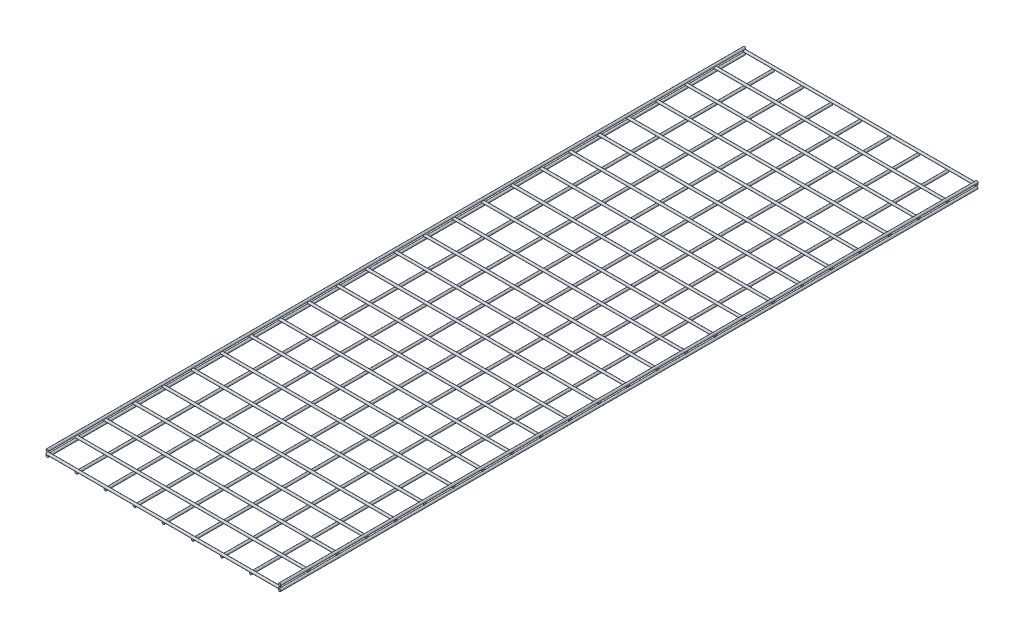
from build123d import *

# Parameters (mm, degrees)
SKETCH1_R              = 3.175
BOSS_EXTRUDE1_DEPTH    = 1828.8
BOSS_EXTRUDE1_2_DEPTH  = 1828.8
BOSS_EXTRUDE1_3_DEPTH  = 1828.8
BOSS_EXTRUDE1_4_DEPTH  = 1828.8
BOSS_EXTRUDE1_5_DEPTH  = 1828.8
BOSS_EXTRUDE1_6_DEPTH  = 1828.8
BOSS_EXTRUDE1_7_DEPTH  = 1828.8
BOSS_EXTRUDE1_8_DEPTH  = 1828.8
BOSS_EXTRUDE1_9_DEPTH  = 1828.8
BOSS_EXTRUDE1_10_DEPTH = 1828.8
BOSS_EXTRUDE1_11_DEPTH = 1828.8
SKETCH2_R              = 3.175
BOSS_EXTRUDE2_DEPTH    = 609.6
BOSS_EXTRUDE2_2_DEPTH  = 609.6
BOSS_EXTRUDE2_3_DEPTH  = 609.6
BOSS_EXTRUDE2_4_DEPTH  = 609.6
BOSS_EXTRUDE2_5_DEPTH  = 609.6
BOSS_EXTRUDE2_6_DEPTH  = 609.6
BOSS_EXTRUDE2_7_DEPTH  = 609.6
BOSS_EXTRUDE2_8_DEPTH  = 609.6
BOSS_EXTRUDE2_9_DEPTH  = 609.6
BOSS_EXTRUDE2_10_DEPTH = 609.6
BOSS_EXTRUDE2_11_DEPTH = 609.6
BOSS_EXTRUDE2_12_DEPTH = 609.6
BOSS_EXTRUDE2_13_DEPTH = 609.6
BOSS_EXTRUDE2_14_DEPTH = 609.6
BOSS_EXTRUDE2_15_DEPTH = 609.6
BOSS_EXTRUDE2_16_DEPTH = 609.6
BOSS_EXTRUDE2_17_DEPTH = 609.6
BOSS_EXTRUDE2_18_DEPTH = 609.6
BOSS_EXTRUDE2_19_DEPTH = 609.6
BOSS_EXTRUDE2_20_DEPTH = 609.6
BOSS_EXTRUDE2_21_DEPTH = 609.6
BOSS_EXTRUDE2_22_DEPTH = 609.6
BOSS_EXTRUDE2_23_DEPTH = 609.6
BOSS_EXTRUDE2_24_DEPTH = 609.6
BOSS_EXTRUDE2_25_DEPTH = 609.6


with BuildPart() as part:
    # Sketch1 → Boss-Extrude1 (new body)
    with BuildSketch(Plane.XY):
        Circle(SKETCH1_R)
    extrude(amount=BOSS_EXTRUDE1_DEPTH)


with BuildPart() as body_2:
    # Sketch1 → Boss-Extrude1 2 (new body)
    with BuildSketch(Plane.XY):
        with Locations((0, 12.7)):
            Circle(SKETCH1_R)
    extrude(amount=BOSS_EXTRUDE1_2_DEPTH)


with BuildPart() as body_3:
    # Sketch1 → Boss-Extrude1 3 (new body)
    with BuildSketch(Plane.XY):
        with Locations((76.2, 0)):
            Circle(SKETCH1_R)
    extrude(amount=BOSS_EXTRUDE1_3_DEPTH)


with BuildPart() as body_4:
    # Sketch1 → Boss-Extrude1 4 (new body)
    with BuildSketch(Plane.XY):
        with Locations((152.4, 0)):
            Circle(SKETCH1_R)
    extrude(amount=BOSS_EXTRUDE1_4_DEPTH)


with BuildPart() as body_5:
    # Sketch1 → Boss-Extrude1 5 (new body)
    with BuildSketch(Plane.XY):
        with Locations((228.6, 0)):
            Circle(SKETCH1_R)
    extrude(amount=BOSS_EXTRUDE1_5_DEPTH)


with BuildPart() as body_6:
    # Sketch1 → Boss-Extrude1 6 (new body)
    with BuildSketch(Plane.XY):
        with Locations((304.8, 0)):
            Circle(SKETCH1_R)
    extrude(amount=BOSS_EXTRUDE1_6_DEPTH)


with BuildPart() as body_7:
    # Sketch1 → Boss-Extrude1 7 (new body)
    with BuildSketch(Plane.XY):
        with Locations((381, 0)):
            Circle(SKETCH1_R)
    extrude(amount=BOSS_EXTRUDE1_7_DEPTH)


with BuildPart() as body_8:
    # Sketch1 → Boss-Extrude1 8 (new body)
    with BuildSketch(Plane.XY):
        with Locations((457.2, 0)):
            Circle(SKETCH1_R)
    extrude(amount=BOSS_EXTRUDE1_8_DEPTH)


with BuildPart() as body_9:
    # Sketch1 → Boss-Extrude1 9 (new body)
    with BuildSketch(Plane.XY):
        with Locations((533.4, 0)):
            Circle(SKETCH1_R)
    extrude(amount=BOSS_EXTRUDE1_9_DEPTH)


with BuildPart() as body_10:
    # Sketch1 → Boss-Extrude1 10 (new body)
    with BuildSketch(Plane.XY):
        with Locations((609.6, 0)):
            Circle(SKETCH1_R)
    extrude(amount=BOSS_EXTRUDE1_10_DEPTH)


with BuildPart() as body_11:
    # Sketch1 → Boss-Extrude1 11 (new body)
    with BuildSketch(Plane.XY):
        with Locations((609.6, 12.7)):
            Circle(SKETCH1_R)
    extrude(amount=BOSS_EXTRUDE1_11_DEPTH)


with BuildPart() as body_12:
    # Sketch2 → Boss-Extrude2 (new body)
    with BuildSketch(Plane(origin=(0, 0, 0), x_dir=(0, 0, -1), z_dir=(1, 0, 0))):
        with Locations((0, 6.35)):
            Circle(SKETCH2_R)
    extrude(amount=BOSS_EXTRUDE2_DEPTH)


with BuildPart() as body_13:
    # Sketch2 → Boss-Extrude2 2 (new body)
    with BuildSketch(Plane(origin=(0, 0, 0), x_dir=(0, 0, -1), z_dir=(1, 0, 0))):
        with Locations((-76.2, 6.35)):
            Circle(SKETCH2_R)
    extrude(amount=BOSS_EXTRUDE2_2_DEPTH)


with BuildPart() as body_14:
    # Sketch2 → Boss-Extrude2 3 (new body)
    with BuildSketch(Plane(origin=(0, 0, 0), x_dir=(0, 0, -1), z_dir=(1, 0, 0))):
        with Locations((-152.4, 6.35)):
            Circle(SKETCH2_R)
    extrude(amount=BOSS_EXTRUDE2_3_DEPTH)


with BuildPart() as body_15:
    # Sketch2 → Boss-Extrude2 4 (new body)
    with BuildSketch(Plane(origin=(0, 0, 0), x_dir=(0, 0, -1), z_dir=(1, 0, 0))):
        with Locations((-228.6, 6.35)):
            Circle(SKETCH2_R)
    extrude(amount=BOSS_EXTRUDE2_4_DEPTH)


with BuildPart() as body_16:
    # Sketch2 → Boss-Extrude2 5 (new body)
    with BuildSketch(Plane(origin=(0, 0, 0), x_dir=(0, 0, -1), z_dir=(1, 0, 0))):
        with Locations((-304.8, 6.35)):
            Circle(SKETCH2_R)
    extrude(amount=BOSS_EXTRUDE2_5_DEPTH)


with BuildPart() as body_17:
    # Sketch2 → Boss-Extrude2 6 (new body)
    with BuildSketch(Plane(origin=(0, 0, 0), x_dir=(0, 0, -1), z_dir=(1, 0, 0))):
        with Locations((-381, 6.35)):
            Circle(SKETCH2_R)
    extrude(amount=BOSS_EXTRUDE2_6_DEPTH)


with BuildPart() as body_18:
    # Sketch2 → Boss-Extrude2 7 (new body)
    with BuildSketch(Plane(origin=(0, 0, 0), x_dir=(0, 0, -1), z_dir=(1, 0, 0))):
        with Locations((-457.2, 6.35)):
            Circle(SKETCH2_R)
    extrude(amount=BOSS_EXTRUDE2_7_DEPTH)


with BuildPart() as body_19:
    # Sketch2 → Boss-Extrude2 8 (new body)
    with BuildSketch(Plane(origin=(0, 0, 0), x_dir=(0, 0, -1), z_dir=(1, 0, 0))):
        with Locations((-533.4, 6.35)):
            Circle(SKETCH2_R)
    extrude(amount=BOSS_EXTRUDE2_8_DEPTH)


with BuildPart() as body_20:
    # Sketch2 → Boss-Extrude2 9 (new body)
    with BuildSketch(Plane(origin=(0, 0, 0), x_dir=(0, 0, -1), z_dir=(1, 0, 0))):
        with Locations((-609.6, 6.35)):
            Circle(SKETCH2_R)
    extrude(amount=BOSS_EXTRUDE2_9_DEPTH)


with BuildPart() as body_21:
    # Sketch2 → Boss-Extrude2 10 (new body)
    with BuildSketch(Plane(origin=(0, 0, 0), x_dir=(0, 0, -1), z_dir=(1, 0, 0))):
        with Locations((-685.8, 6.35)):
            Circle(SKETCH2_R)
    extrude(amount=BOSS_EXTRUDE2_10_DEPTH)


with BuildPart() as body_22:
    # Sketch2 → Boss-Extrude2 11 (new body)
    with BuildSketch(Plane(origin=(0, 0, 0), x_dir=(0, 0, -1), z_dir=(1, 0, 0))):
        with Locations((-762, 6.35)):
            Circle(SKETCH2_R)
    extrude(amount=BOSS_EXTRUDE2_11_DEPTH)


with BuildPart() as body_23:
    # Sketch2 → Boss-Extrude2 12 (new body)
    with BuildSketch(Plane(origin=(0, 0, 0), x_dir=(0, 0, -1), z_dir=(1, 0, 0))):
        with Locations((-838.2, 6.35)):
            Circle(SKETCH2_R)
    extrude(amount=BOSS_EXTRUDE2_12_DEPTH)


with BuildPart() as body_24:
    # Sketch2 → Boss-Extrude2 13 (new body)
    with BuildSketch(Plane(origin=(0, 0, 0), x_dir=(0, 0, -1), z_dir=(1, 0, 0))):
        with Locations((-914.4, 6.35)):
            Circle(SKETCH2_R)
    extrude(amount=BOSS_EXTRUDE2_13_DEPTH)


with BuildPart() as body_25:
    # Sketch2 → Boss-Extrude2 14 (new body)
    with BuildSketch(Plane(origin=(0, 0, 0), x_dir=(0, 0, -1), z_dir=(1, 0, 0))):
        with Locations((-990.6, 6.35)):
            Circle(SKETCH2_R)
    extrude(amount=BOSS_EXTRUDE2_14_DEPTH)


with BuildPart() as body_26:
    # Sketch2 → Boss-Extrude2 15 (new body)
    with BuildSketch(Plane(origin=(0, 0, 0), x_dir=(0, 0, -1), z_dir=(1, 0, 0))):
        with Locations((-1066.8, 6.35)):
            Circle(SKETCH2_R)
    extrude(amount=BOSS_EXTRUDE2_15_DEPTH)


with BuildPart() as body_27:
    # Sketch2 → Boss-Extrude2 16 (new body)
    with BuildSketch(Plane(origin=(0, 0, 0), x_dir=(0, 0, -1), z_dir=(1, 0, 0))):
        with Locations((-1143, 6.35)):
            Circle(SKETCH2_R)
    extrude(amount=BOSS_EXTRUDE2_16_DEPTH)


with BuildPart() as body_28:
    # Sketch2 → Boss-Extrude2 17 (new body)
    with BuildSketch(Plane(origin=(0, 0, 0), x_dir=(0, 0, -1), z_dir=(1, 0, 0))):
        with Locations((-1219.2, 6.35)):
            Circle(SKETCH2_R)
    extrude(amount=BOSS_EXTRUDE2_17_DEPTH)


with BuildPart() as body_29:
    # Sketch2 → Boss-Extrude2 18 (new body)
    with BuildSketch(Plane(origin=(0, 0, 0), x_dir=(0, 0, -1), z_dir=(1, 0, 0))):
        with Locations((-1295.4, 6.35)):
            Circle(SKETCH2_R)
    extrude(amount=BOSS_EXTRUDE2_18_DEPTH)


with BuildPart() as body_30:
    # Sketch2 → Boss-Extrude2 19 (new body)
    with BuildSketch(Plane(origin=(0, 0, 0), x_dir=(0, 0, -1), z_dir=(1, 0, 0))):
        with Locations((-1371.6, 6.35)):
            Circle(SKETCH2_R)
    extrude(amount=BOSS_EXTRUDE2_19_DEPTH)


with BuildPart() as body_31:
    # Sketch2 → Boss-Extrude2 20 (new body)
    with BuildSketch(Plane(origin=(0, 0, 0), x_dir=(0, 0, -1), z_dir=(1, 0, 0))):
        with Locations((-1447.8, 6.35)):
            Circle(SKETCH2_R)
    extrude(amount=BOSS_EXTRUDE2_20_DEPTH)


with BuildPart() as body_32:
    # Sketch2 → Boss-Extrude2 21 (new body)
    with BuildSketch(Plane(origin=(0, 0, 0), x_dir=(0, 0, -1), z_dir=(1, 0, 0))):
        with Locations((-1524, 6.35)):
            Circle(SKETCH2_R)
    extrude(amount=BOSS_EXTRUDE2_21_DEPTH)


with BuildPart() as body_33:
    # Sketch2 → Boss-Extrude2 22 (new body)
    with BuildSketch(Plane(origin=(0, 0, 0), x_dir=(0, 0, -1), z_dir=(1, 0, 0))):
        with Locations((-1600.2, 6.35)):
            Circle(SKETCH2_R)
    extrude(amount=BOSS_EXTRUDE2_22_DEPTH)


with BuildPart() as body_34:
    # Sketch2 → Boss-Extrude2 23 (new body)
    with BuildSketch(Plane(origin=(0, 0, 0), x_dir=(0, 0, -1), z_dir=(1, 0, 0))):
        with Locations((-1676.4, 6.35)):
            Circle(SKETCH2_R)
    extrude(amount=BOSS_EXTRUDE2_23_DEPTH)


with BuildPart() as body_35:
    # Sketch2 → Boss-Extrude2 24 (new body)
    with BuildSketch(Plane(origin=(0, 0, 0), x_dir=(0, 0, -1), z_dir=(1, 0, 0))):
        with Locations((-1752.6, 6.35)):
            Circle(SKETCH2_R)
    extrude(amount=BOSS_EXTRUDE2_24_DEPTH)


with BuildPart() as body_36:
    # Sketch2 → Boss-Extrude2 25 (new body)
    with BuildSketch(Plane(origin=(0, 0, 0), x_dir=(0, 0, -1), z_dir=(1, 0, 0))):
        with Locations((-1828.8, 6.35)):
            Circle(SKETCH2_R)
    extrude(amount=BOSS_EXTRUDE2_25_DEPTH)


solid = Compound([part.part, body_2.part, body_3.part, body_4.part, body_5.part, body_6.part, body_7.part, body_8.part, body_9.part, body_10.part, body_11.part, body_12.part, body_13.part, body_14.part, body_15.part, body_16.part, body_17.part, body_18.part, body_19.part, body_20.part, body_21.part, body_22.part, body_23.part, body_24.part, body_25.part, body_26.part, body_27.part, body_28.part, body_29.part, body_30.part, body_31.part, body_32.part, body_33.part, body_34.part, body_35.part, body_36.part])
